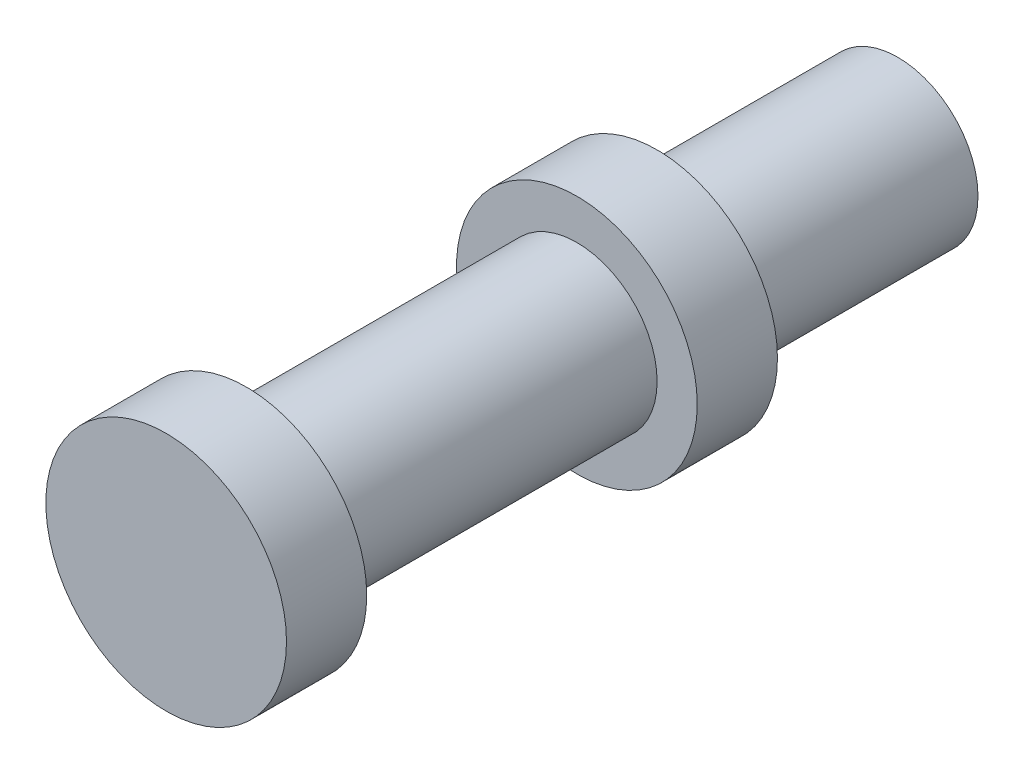
from build123d import *

# Parameters (mm, degrees)
SKETCH1_R               = 1
BOSS_EXTRUDE1_DEPTH     = 9.12
BOSS_EXTRUDE2_START     = 3
BOSS_EXTRUDE2_OUTLINE_R = 1.5
BOSS_EXTRUDE2_DEPTH     = 1
BOSS_EXTRUDE3_START     = -1
SKETCH2_R               = 1.5
BOSS_EXTRUDE3_DEPTH     = 1


# Read off the part's stored shape, not the designer's step: Boss-Extrude2
with BuildPart() as part:
    # Sketch1 → Boss-Extrude1 (new body)
    with BuildSketch(Plane.XY):
        Circle(SKETCH1_R)
    extrude(amount=BOSS_EXTRUDE1_DEPTH)

    # Boss-Extrude2 outline → Boss-Extrude2 (add)
    with BuildSketch(Plane.XY.offset(BOSS_EXTRUDE2_START)):
        Circle(BOSS_EXTRUDE2_OUTLINE_R)
    extrude(amount=BOSS_EXTRUDE2_DEPTH)

    # Sketch2 → Boss-Extrude3 (add)
    with BuildSketch(Plane.XY.offset(9.12).offset(BOSS_EXTRUDE3_START)):
        Circle(SKETCH2_R)
    extrude(amount=BOSS_EXTRUDE3_DEPTH)


solid = part.part
